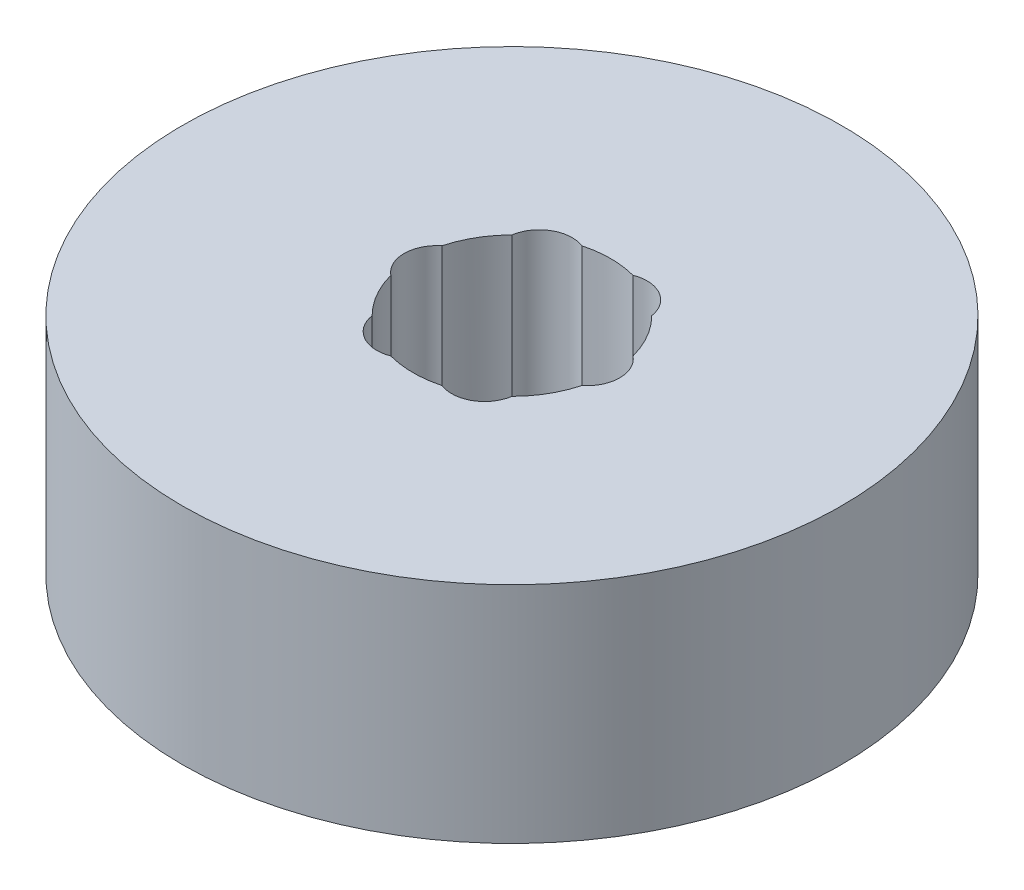
from build123d import *

# Parameters (mm, degrees)
SKETCH1_R           = 25
BOSS_EXTRUDE1_DEPTH = 17
SKETCH2_R           = 7.5
CUT_EXTRUDE1_DEPTH  = 40.230090492
SKETCH3_R           = 2.490817459
CUT_EXTRUDE2_DEPTH  = 16.959033499
CIRPATTERN1_COUNT   = 6


with BuildPart() as part:
    # Sketch1 → Boss-Extrude1 (new body)
    with BuildSketch(Plane(origin=(0, 0, 0), x_dir=(1, 0, 0), z_dir=(0, 1, 0))):
        Circle(SKETCH1_R)
    extrude(amount=BOSS_EXTRUDE1_DEPTH)

    # Sketch2 → Cut-Extrude1 (cut, through all)
    with BuildSketch(Plane(origin=(0, 0, 0), x_dir=(1, 0, 0), z_dir=(0, 1, 0))):
        Circle(SKETCH2_R)
    extrude(amount=CUT_EXTRUDE1_DEPTH, mode=Mode.SUBTRACT)

    # Sketch3 → Cut-Extrude2 (cut)
    with BuildSketch(Plane(origin=(0, 17, 0), x_dir=(1, 0, 0), z_dir=(0, 1, 0))):
        with Locations((-5.684241055, 0)):
            Circle(SKETCH3_R)
    cut_extrude2 = extrude(amount=-CUT_EXTRUDE2_DEPTH, mode=Mode.SUBTRACT)

    # CirPattern1: Cut-Extrude2 ×6 about axis
    cirpattern1_axis = Axis((0, 0, 0), (0, 1, 0))
    for i in range(1, CIRPATTERN1_COUNT):
        add(cut_extrude2.rotate(cirpattern1_axis, i * 360 / CIRPATTERN1_COUNT), mode=Mode.SUBTRACT)


solid = part.part
